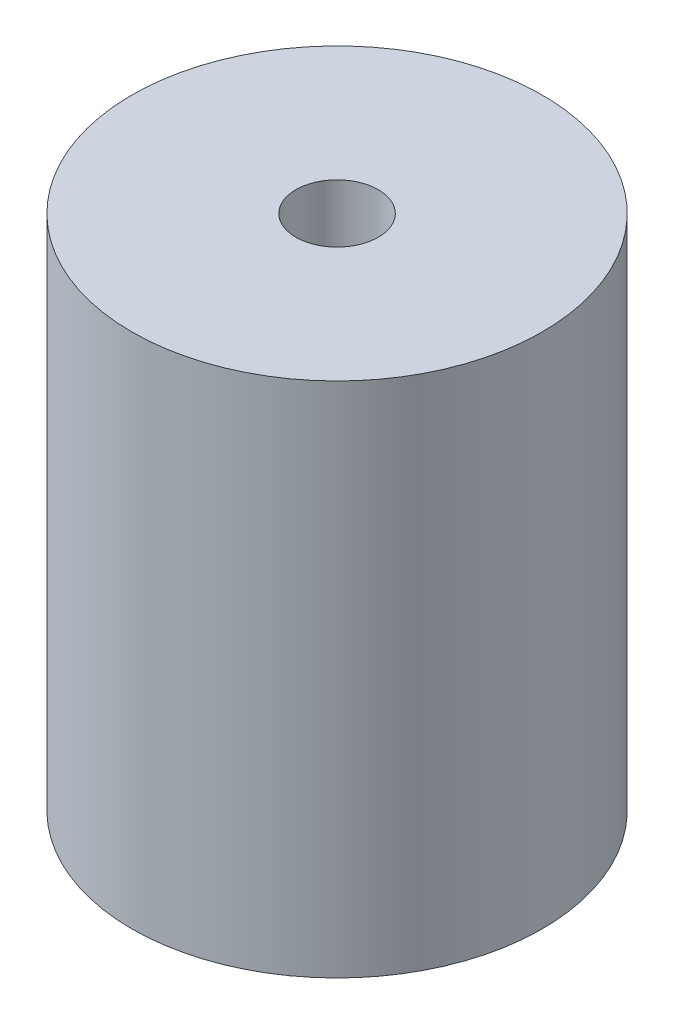
from build123d import *

# Parameters (mm, degrees)
SKETCH1_R                       = 12.7
BOSS_EXTRUDE1_DEPTH             = 32
TAP_DRILL_FOR_1_4_20_TAP1_D     = 5.1054
TAP_DRILL_FOR_1_4_20_TAP1_DEPTH = 10.16
TAP_DRILL_FOR_1_4_20_TAP1_TIP   = 1.533816902
TAP_DRILL_FOR_1_4_20_TAP2_D     = 5.1054
TAP_DRILL_FOR_1_4_20_TAP2_DEPTH = 10.16
TAP_DRILL_FOR_1_4_20_TAP2_TIP   = 1.533816902


with BuildPart() as part:
    # Sketch1 → Boss-Extrude1 (new body)
    with BuildSketch(Plane(origin=(0, 0, 0), x_dir=(1, 0, 0), z_dir=(0, 1, 0))):
        Circle(SKETCH1_R)
    extrude(amount=BOSS_EXTRUDE1_DEPTH)

    # Tap Drill for 1/4-20 Tap1
    with Locations(Plane.XZ):
        with Locations((0, 0)):
            Hole(TAP_DRILL_FOR_1_4_20_TAP1_D / 2, depth=TAP_DRILL_FOR_1_4_20_TAP1_DEPTH)
            with Locations((0, 0, -(TAP_DRILL_FOR_1_4_20_TAP1_DEPTH + TAP_DRILL_FOR_1_4_20_TAP1_TIP / 2))):  # 118° drill point
                Cone(0, TAP_DRILL_FOR_1_4_20_TAP1_D / 2, TAP_DRILL_FOR_1_4_20_TAP1_TIP, mode=Mode.SUBTRACT)

    # Tap Drill for 1/4-20 Tap2
    with Locations(Plane(origin=(0, 32, 0), x_dir=(1, 0, 0), z_dir=(0, 1, 0))):
        with Locations((0, 0)):
            Hole(TAP_DRILL_FOR_1_4_20_TAP2_D / 2, depth=TAP_DRILL_FOR_1_4_20_TAP2_DEPTH)
            with Locations((0, 0, -(TAP_DRILL_FOR_1_4_20_TAP2_DEPTH + TAP_DRILL_FOR_1_4_20_TAP2_TIP / 2))):  # 118° drill point
                Cone(0, TAP_DRILL_FOR_1_4_20_TAP2_D / 2, TAP_DRILL_FOR_1_4_20_TAP2_TIP, mode=Mode.SUBTRACT)


solid = part.part
